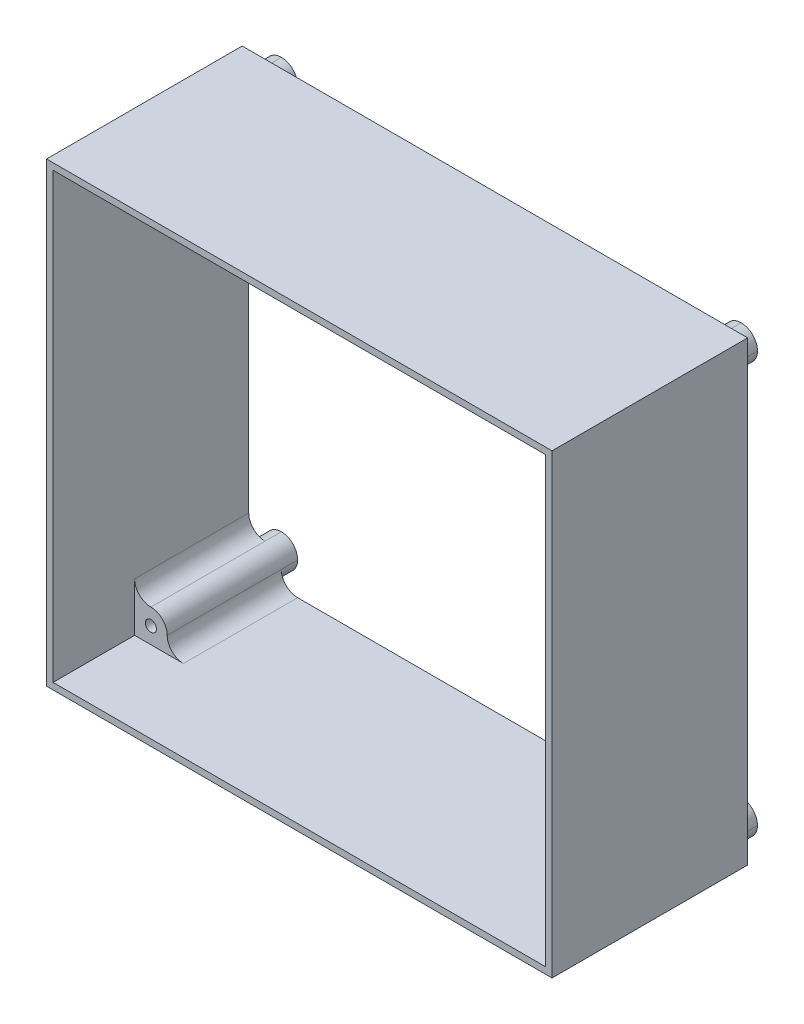
from build123d import *

# Parameters (mm, degrees)
SKIZZE1_W                                      = 155
SKIZZE1_H                                      = 140
SKIZZE1_W_2                                    = 151
SKIZZE1_H_2                                    = 136
AUFSATZ_LINEAR_AUSTRAGEN2_DEPTH                = 60
AUFSATZ_LINEAR_START                           = -3
AUFSATZ_LINEAR_AUSTRAGEN6_OUTLINE_R            = 14
AUFSATZ_LINEAR_AUSTRAGEN6_OUTLINE_R_2          = 13
AUFSATZ_LINEAR_AUSTRAGEN6_DEPTH                = 4
AUFSATZ_LINEAR_AUSTRAGEN8_DEPTH                = 25
AUFSATZ_LINEAR_AUSTRAGEN8_DEPTH_BACK           = 15
VERRUNDUNG17_R                                 = 5
VERRUNDUNG18_R                                 = 5
FORMSENKUNG_F_R_M3_LINSENSENKSCHRAUBE1_A_COUNT = 2
FORMSENKUNG_F_R_M3_LINSENSENKSCHRAUBE1_A_PITCH = 126
FORMSENKUNG_F_R_M3_LINSENSENKSCHRAUB_2_COUNT   = 2
FORMSENKUNG_F_R_M3_LINSENSENKSCHRAUB_2_PITCH   = 189.0952141118331
FORMSENKUNG_F_R_M3_LINSENSENKSCHRAUB_3_COUNT   = 2
FORMSENKUNG_F_R_M3_LINSENSENKSCHRAUB_3_PITCH   = 141


# Read off the part's stored shape, not the designer's step: Aufsatz-Linear austragen6
with BuildPart() as part:
    # Skizze1 → Aufsatz-Linear austragen2 (new body)
    with BuildSketch(Plane.XY):
        Rectangle(SKIZZE1_W, SKIZZE1_H)
        Rectangle(SKIZZE1_W_2, SKIZZE1_H_2, mode=Mode.SUBTRACT)
    extrude(amount=AUFSATZ_LINEAR_AUSTRAGEN2_DEPTH)

    # 3D-Skizze1 → Aufsatz-Linear austragen8 (add, two sides: drawn at the far end of the back side and taken through both)
    with BuildSketch(Plane(origin=(-75.50000000000003, 67.99999999999999, 10.000000000000002), x_dir=(0.7430494130276538, -0.6692365574288803, 0), z_dir=(0, 0, 1)).offset(-AUFSATZ_LINEAR_AUSTRAGEN8_DEPTH_BACK)):
        Polygon((0, 0), (7.430494130276535, 6.6923655742888), (14.122859704565338, -0.7381285559877395), (6.692365574288805, -7.43049413027654), align=None)
        Polygon((112.20046136717572, 101.05472017176092), (104.7699672368992, 94.36235459747213), (111.462332811188, 86.9318604671956), (118.89282694146452, 93.62422604148439), align=None)
        Polygon((203.21663317750344, 0), (195.78613904722692, -6.692365574288789), (189.09377347293812, 0.7381285559877604), (196.52426760321464, 7.430494130276549), align=None)
        Polygon((91.01617181032773, -101.05472017176092), (98.44666594060426, -94.36235459747212), (91.75430036631546, -86.93186046719558), (84.32380623603892, -93.62422604148438), align=None)
    extrude(amount=AUFSATZ_LINEAR_AUSTRAGEN8_DEPTH + AUFSATZ_LINEAR_AUSTRAGEN8_DEPTH_BACK)

    # Verrundung17
    verrundung17_edges = [part.edges().sort_by_distance(p)[0] for p in [
        (75.49999999999994, 58, 17.5),
        (65.49999999999997, 58, 15.000000000000002),
        (65.49999999999997, 67.99999999999999, 17.5),
        (-65.50000000000003, 67.99999999999999, 17.5),
        (-65.50000000000003, 57.999999999999986, 15),
        (-75.50000000000003, 57.999999999999986, 17.5),
        (-75.50000000000003, -57.999999999999986, 17.5),
        (-65.50000000000003, -68.00000000000001, 17.5),
        (-65.50000000000003, -58, 15.000000000000002),
        (65.49999999999997, -68.00000000000001, 17.5),
        (75.49999999999994, -58, 17.5),
        (65.5, -58, 15),
    ]]
    fillet(verrundung17_edges, radius=VERRUNDUNG17_R - 0.0001)  # a hair under: the kernel refuses the full size

    # Verrundung18
    verrundung18_edges = [part.edges().sort_by_distance(p)[0] for p in [
        (65.49999999999997, 67.99999999999999, -2.499999999999999),
        (75.49999999999994, 67.99999999999999, -2.5),
        (75.49999999999994, 58, -2.5),
        (-75.50000000000003, -57.999999999999986, -2.5),
        (-65.50000000000003, 67.99999999999999, -2.5),
        (-75.50000000000003, 67.99999999999999, -2.499999999999999),
        (-75.50000000000003, 57.999999999999986, -2.499999999999999),
        (-75.50000000000001, -68.00000000000001, -2.5),
        (-65.50000000000003, -68.00000000000001, -2.499999999999999),
        (65.49999999999997, -68.00000000000001, -2.5),
        (75.49999999999994, -58, -2.499999999999999),
        (75.49999999999994, -68.00000000000001, -2.499999999999999),
    ]]
    fillet(verrundung18_edges, radius=VERRUNDUNG18_R - 0.0001)  # a hair under: the kernel refuses the full size

    # Skizze18 → Formsenkung für M3 Linsensenkschraube1 (revolve, cut)
    with BuildSketch(Plane(origin=(70.49999999999999, -63.000000000000014, -4.999999999999999), x_dir=(0, 1, 0), z_dir=(1, 0, 0))):
        Polygon((0, 0), (-9.8e-15, 40.00110307764064), (1.69999999999999, 40.00110307764064), (1.6999999999999953, 1.45), (3.15, 0), align=None)
    formsenkung_f_r_m3_linsensenkschraube1 = revolve(axis=Axis((70.49999999999999, -63.000000000000014, -11.34999999999999), (0, 0, 1)), mode=Mode.SUBTRACT)

    # Formsenkung für M3 Linsensenkschraube1 a: Formsenkung für M3 Linsensenkschraube1 ×2
    with Locations(*[(0, i * FORMSENKUNG_F_R_M3_LINSENSENKSCHRAUBE1_A_PITCH, 0) for i in range(1, FORMSENKUNG_F_R_M3_LINSENSENKSCHRAUBE1_A_COUNT)]):
        add(formsenkung_f_r_m3_linsensenkschraube1, mode=Mode.SUBTRACT)

    # Formsenkung f_r M3 Linsensenkschraub 2: Formsenkung für M3 Linsensenkschraube1 ×2
    with Locations(*[Vector(-0.7456561006171789, 0.666330983530245, 0) * (i * FORMSENKUNG_F_R_M3_LINSENSENKSCHRAUB_2_PITCH) for i in range(1, FORMSENKUNG_F_R_M3_LINSENSENKSCHRAUB_2_COUNT)]):
        add(formsenkung_f_r_m3_linsensenkschraube1, mode=Mode.SUBTRACT)

    # Formsenkung f_r M3 Linsensenkschraub 3: Formsenkung für M3 Linsensenkschraube1 ×2
    with Locations(*[(-i * FORMSENKUNG_F_R_M3_LINSENSENKSCHRAUB_3_PITCH, 0, 0) for i in range(1, FORMSENKUNG_F_R_M3_LINSENSENKSCHRAUB_3_COUNT)]):
        add(formsenkung_f_r_m3_linsensenkschraube1, mode=Mode.SUBTRACT)


with BuildPart() as body_2:
    # Aufsatz-Linear austragen6 outline → Aufsatz-Linear austragen6 (new body)
    with BuildSketch(Plane.XY.offset(AUFSATZ_LINEAR_START)):
        with Locations((30.5, -9)):
            Circle(AUFSATZ_LINEAR_AUSTRAGEN6_OUTLINE_R)
        with Locations((30.5, -9)):
            Circle(AUFSATZ_LINEAR_AUSTRAGEN6_OUTLINE_R_2, mode=Mode.SUBTRACT)
    extrude(amount=AUFSATZ_LINEAR_AUSTRAGEN6_DEPTH)


solid = Compound([part.part, body_2.part])
